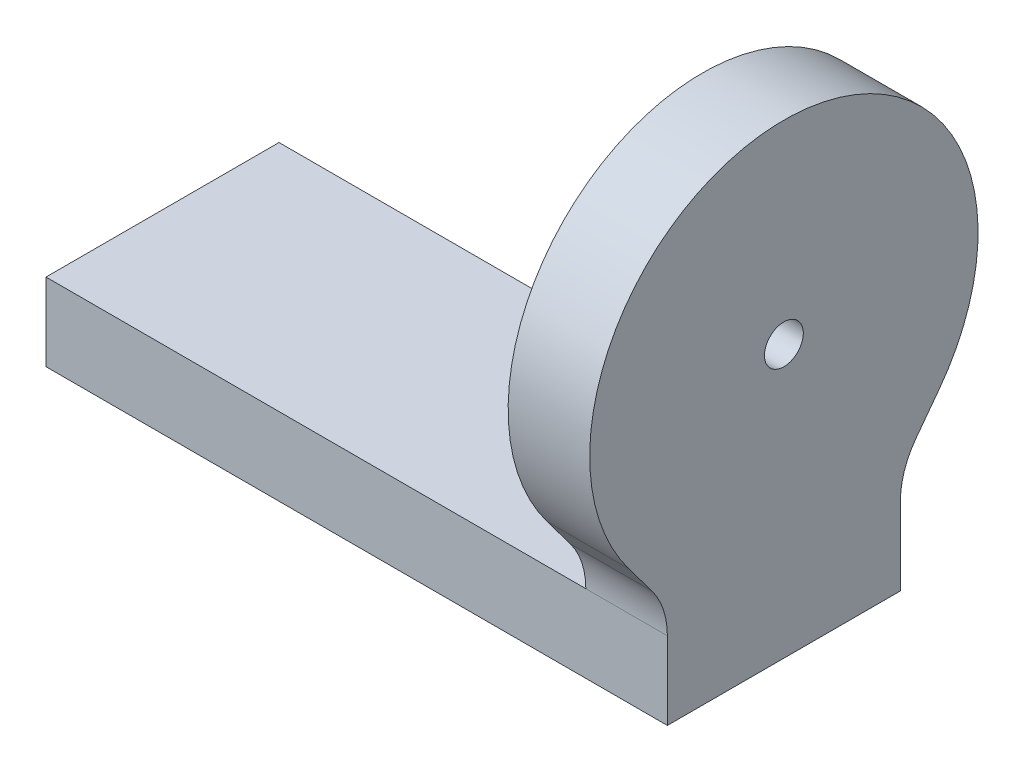
from build123d import *

# Parameters (mm, degrees)
BOSS_EXTRUDE1_DEPTH = 50
CUT_EXTRUDE1_DEPTH  = 105.547835941
SKETCH3_R           = 2.5
CUT_EXTRUDE2_DEPTH  = 105.547835941
SKETCH4_W           = 80
SKETCH4_H           = 10
CUT_EXTRUDE3_DEPTH  = 82.240384046
CUT_EXTRUDE4_START  = -10.5
CUT_EXTRUDE4_DEPTH  = 10.5


# Read off the part's stored shape, not the designer's step: Cut-Extrude4
with BuildPart() as part:
    # Sketch1 → Boss-Extrude1 (new body)
    with BuildSketch(Plane.XY):
        Polygon((29.5, 60), (29.5, 10), (-40, 10), (-40, 0), (40, 0), (40, 60), align=None)
    extrude(amount=-BOSS_EXTRUDE1_DEPTH)

    # Sketch2 → Cut-Extrude1 (cut, through all)
    with BuildSketch(Plane.ZY.offset(-29.5)):
        with BuildLine():
            Line((-50, 60), (-50, 35))
            ThreePointArc((-50, 35), (-42.67766953, 52.67766953), (-25, 60))
            Line((-25, 60), (-50, 60))
        make_face()
        with BuildLine():
            Line((0, 60), (-25, 60))
            ThreePointArc((-25, 60), (-7.32233047, 52.67766953), (0, 35))
            Line((0, 35), (0, 60))
        make_face()
    extrude(amount=-CUT_EXTRUDE1_DEPTH, mode=Mode.SUBTRACT)

    # Sketch3 → Cut-Extrude2 (cut, through all)
    with BuildSketch(Plane.ZY.offset(-29.5)):
        with Locations((-25, 35)):
            Circle(SKETCH3_R)
    extrude(amount=-CUT_EXTRUDE2_DEPTH, mode=Mode.SUBTRACT)

    # Sketch4 → Cut-Extrude3 (cut, through all)
    with BuildSketch(Plane(origin=(0, 10, 0), x_dir=(1, 0, 0), z_dir=(0, 1, 0))):
        with Locations((0, 45)):
            Rectangle(SKETCH4_W, SKETCH4_H)
        with Locations((0, 5)):
            Rectangle(SKETCH4_W, SKETCH4_H)
    extrude(amount=-CUT_EXTRUDE3_DEPTH, mode=Mode.SUBTRACT)

    # Cut-Extrude4 outline → Cut-Extrude4 (cut)
    with BuildSketch(Plane.ZY.offset(-29.5).offset(CUT_EXTRUDE4_START)):
        with BuildLine():
            ThreePointArc((-45, 20), (-48.717082451, 27.09430585), (-50, 35))
            Line((-50, 35), (-50, 10))
            Line((-50, 10), (-40, 10))
            ThreePointArc((-40, 10), (-40.513167019, 13.16227766), (-42, 16))
            Line((-42, 16), (-45, 20))
        make_face()
        with BuildLine():
            ThreePointArc((0, 35), (-1.293142852, 27.063695813), (-5.038793932, 19.948413628))
            Line((-5.038793932, 19.948413628), (-8, 16))
            ThreePointArc((-8, 16), (-9.486832981, 13.16227766), (-10, 10))
            Line((-10, 10), (0, 10))
            Line((0, 10), (0, 35))
        make_face()
    extrude(amount=CUT_EXTRUDE4_DEPTH, mode=Mode.SUBTRACT)


solid = part.part
